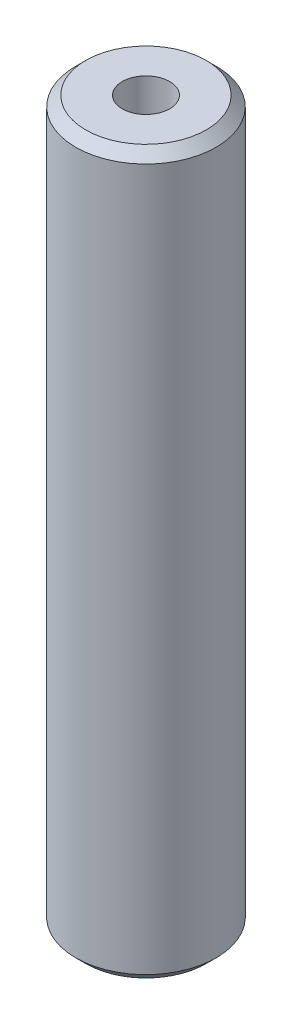
from build123d import *

# Parameters (mm, degrees)
SKETCH1_R           = 7.5
BOSS_EXTRUDE1_DEPTH = 77.090613012
SKETCH2_R           = 2.529461808
CUT_EXTRUDE1_DEPTH  = 78.816853024
CHAMFER1_SIZE       = 1.069107121


with BuildPart() as part:
    # Sketch1 → Boss-Extrude1 (new body)
    with BuildSketch(Plane(origin=(0, 0, 0), x_dir=(1, 0, 0), z_dir=(0, 1, 0))):
        Circle(SKETCH1_R)
    extrude(amount=BOSS_EXTRUDE1_DEPTH)

    # Sketch2 → Cut-Extrude1 (cut, through all)
    with BuildSketch(Plane(origin=(0, 0, 0), x_dir=(1, 0, 0), z_dir=(0, 1, 0))):
        Circle(SKETCH2_R)
    extrude(amount=CUT_EXTRUDE1_DEPTH, mode=Mode.SUBTRACT)

    # Chamfer1
    chamfer1_edges = [part.edges().sort_by_distance(p)[0] for p in [
        (-7.5, 77.090613012, 0),
        (-7.5, 0, 0),
    ]]
    chamfer(chamfer1_edges, length=CHAMFER1_SIZE)


solid = part.part
